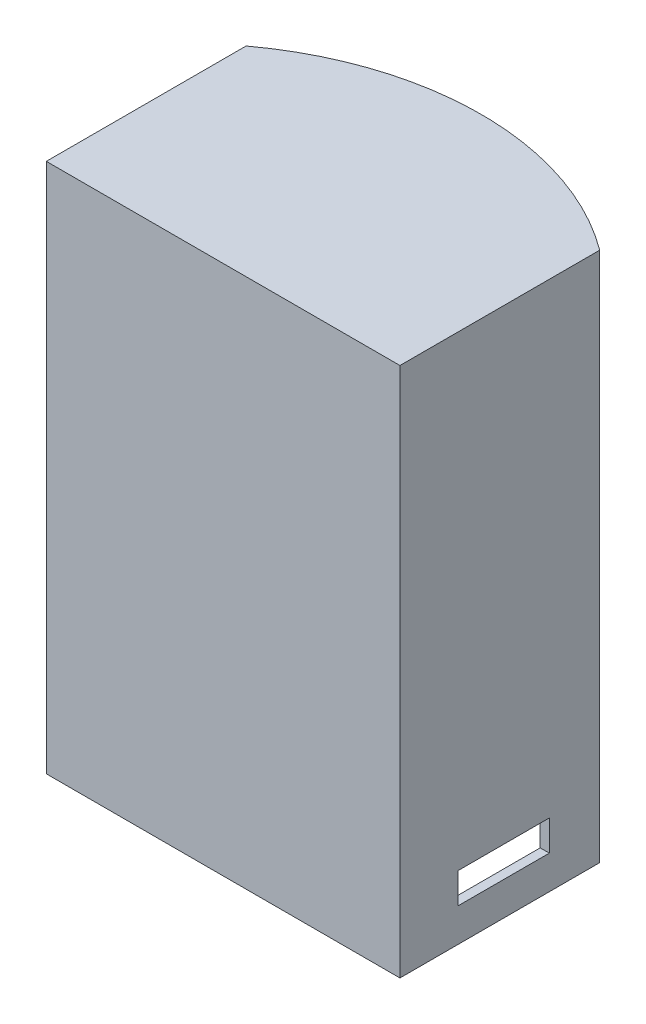
from build123d import *

# Parameters (mm, degrees)
BOSS_EXTRUDE1_DEPTH = 85
BOSS_EXTRUDE3_DEPTH = 2
SKETCH9_W           = 11.5
SKETCH9_H           = 2
BOSS_EXTRUDE8_DEPTH = 3
CHAMFER1_SIZE       = 3
SKETCH10_W          = 32
SKETCH10_H          = 85
BOSS_EXTRUDE9_DEPTH = 2
SKETCH11_W          = 15
SKETCH11_H          = 5
CUT_EXTRUDE1_DEPTH  = 108.588010242


with BuildPart() as part:
    # Sketch1 → Boss-Extrude1 (new body)
    with BuildSketch(Plane(origin=(0, 0, 0), x_dir=(1, 0, 0), z_dir=(0, 1, 0))):
        with BuildLine():
            Line((-29, -15), (-29, 15.762564303))
            ThreePointArc((-29, 15.762564303), (0, 25.341269657), (29, 15.762564303))
            Line((29, 15.762564303), (29, -15))
            Line((29, -15), (29, -17))
            Line((29, -17), (27.5, -17))
            Line((27.5, -17), (16, -17))
            Line((16, -17), (16, -15))
            Line((16, -15), (27.5, -15))
            Line((27.5, -15), (27.5, 15))
            ThreePointArc((27.5, 15), (0, 23.841269657), (-27.5, 15))
            Line((-27.5, 15), (-27.5, -15))
            Line((-27.5, -15), (-16, -15))
            Line((-16, -15), (-16, -17))
            Line((-16, -17), (-27.5, -17))
            Line((-27.5, -17), (-29, -17))
            Line((-29, -17), (-29, -15))
        make_face()
    extrude(amount=BOSS_EXTRUDE1_DEPTH)

    # Sketch3 → Boss-Extrude3 (add)
    with BuildSketch(Plane(origin=(0, 85, 0), x_dir=(1, 0, 0), z_dir=(0, 1, 0))):
        with BuildLine():
            Line((-16, -17), (16, -17))
            Line((16, -17), (29, -17))
            Line((29, -17), (29, 15.762564303))
            ThreePointArc((29, 15.762564303), (0, 25.341269657), (-29, 15.762564303))
            Line((-29, 15.762564303), (-29, -17))
            Line((-29, -17), (-16, -17))
        make_face()
    extrude(amount=BOSS_EXTRUDE3_DEPTH)

    # Sketch9 → Boss-Extrude8 (add)
    with BuildSketch(Plane(origin=(0, 0, 15), x_dir=(-1, 0, 0), z_dir=(0, 0, -1))):
        with Locations((-21.75, 15)):
            Rectangle(SKETCH9_W, SKETCH9_H)
        with Locations((21.75, 15)):
            Rectangle(SKETCH9_W, SKETCH9_H)
    extrude(amount=BOSS_EXTRUDE8_DEPTH)

    # Chamfer1
    chamfer1_edges = [part.edges().sort_by_distance(p)[0] for p in [
        (-21.75, 14, 15),
        (21.75, 14, 15),
    ]]
    chamfer(chamfer1_edges, length=CHAMFER1_SIZE - 0.0001)  # a hair under: the kernel refuses the full size

    # Sketch10 → Boss-Extrude9 (add)
    with BuildSketch(Plane.XY.offset(17)):
        with Locations((0, 42.5)):
            Rectangle(SKETCH10_W, SKETCH10_H)
    extrude(amount=-BOSS_EXTRUDE9_DEPTH)

    # Sketch11 → Cut-Extrude1 (cut, through all)
    with BuildSketch(Plane(origin=(29, 0, 0), x_dir=(0, 0, -1), z_dir=(1, 0, 0))):
        with Locations((0, 7.985525628)):
            Rectangle(SKETCH11_W, SKETCH11_H)
    extrude(amount=-CUT_EXTRUDE1_DEPTH, mode=Mode.SUBTRACT)


solid = part.part
